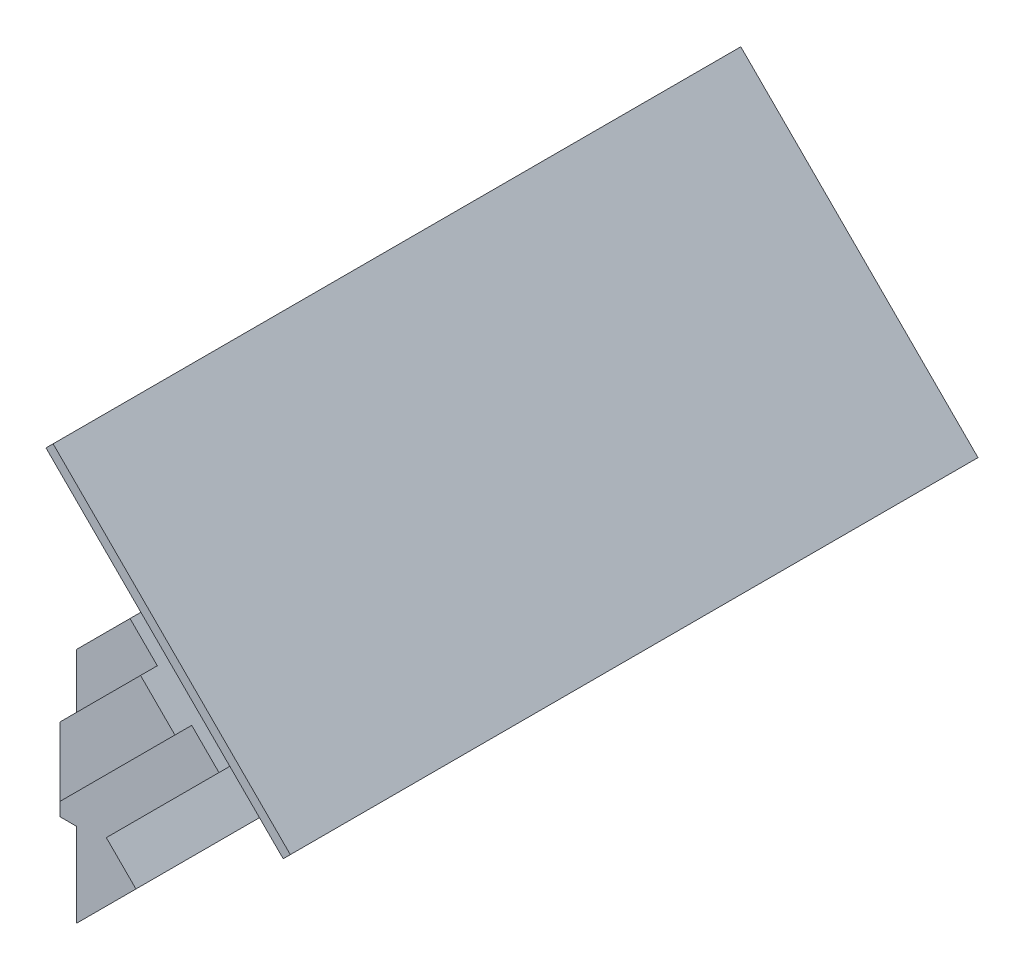
from build123d import *

# Parameters (mm, degrees)
MAIN_EXTRUSION_DEPTH                   = 15
ESQUISSE2_W                            = 10
ESQUISSE2_H                            = 9.5
WINDOW_EXTRUSION_DEPTH                 = 2.5
ESQUISSE5_R                            = 1.25
WINDOW_HOLE_EXTRUSION_DEPTH            = 25.728526038
FIXATION_TOP_MAKERBEAM_EXTRUSION_DEPTH = 10
ESQUISSE3_R                            = 1.5
WINDOW_HOLE_FIXATION_DEPTH             = 34.079263873
ESQUISSE4_R                            = 4.1
CENTRAL_FIXATION_DEPTH                 = 32.269584341
BOSS_EXTRU_2_DEPTH                     = 1
BOSS_EXTRU_6_DEPTH                     = 12
CONG_1_R                               = 4
ESQUISSE11_R                           = 1.6
ENL_V_MAT_EXTRU_2_DEPTH                = 35.185157598
ESQUISSE12_W                           = 41
ESQUISSE12_H                           = 20
BOSS_EXTRU_7_DEPTH                     = 0.6


with BuildPart() as part:
    # Esquisse1 → Main Extrusion (new, symmetric)
    with BuildSketch(Plane.XY):
        Polygon((0, 0), (0, 5), (-1, 5), (-1, 7.9), (0, 7.9), (0, 14.142135624), (3.181980515, 17.324116139), (10.253048327, 10.253048327), align=None)
    extrude(amount=MAIN_EXTRUSION_DEPTH, both=True)

    # Esquisse2 → Window Extrusion (cut)
    with BuildSketch(Plane(origin=(0, 0, 0), x_dir=(0, 0, -1), z_dir=(0.7071067811865512, -0.7071067811865438, 0))):
        with Locations((10, 9.75)):
            Rectangle(ESQUISSE2_W, ESQUISSE2_H)
    window_extrusion = extrude(amount=-WINDOW_EXTRUSION_DEPTH, mode=Mode.SUBTRACT)

    # Esquisse5 → Window Hole Extrusion (cut, through all)
    with BuildSketch(Plane(origin=(-1.767766953, 1.767766953, 0), x_dir=(0, 0, -1), z_dir=(0.7071067811865513, -0.7071067811865438, 0))):
        with Locations((10, 11.5)):
            Circle(ESQUISSE5_R)
    window_hole_extrusion = extrude(amount=-WINDOW_HOLE_EXTRUSION_DEPTH, mode=Mode.SUBTRACT)

    # Esquisse7 → Fixation Top MakerBeam Extrusion (add)
    with BuildSketch(Plane(origin=(10.253048327, 10.253048327, 0), x_dir=(0, 0, -1), z_dir=(0.7071067811865438, 0.7071067811865513, 0))):
        Polygon((-5.1, 2.5), (-5.1, 3.55), (-4.1, 3.55), (-4.1, 6.45), (-5.1, 6.45), (-5.1, 10), (-8.1, 10), (-8.1, 2.5), align=None)
    fixation_top_makerbeam_extrusion = extrude(amount=FIXATION_TOP_MAKERBEAM_EXTRUSION_DEPTH)

    # Window Symetry: Window Extrusion, Window Hole Extrusion, Fixation Top MakerBeam Extrusion across plane
    add(window_extrusion.mirror(Plane.XY), mode=Mode.SUBTRACT)
    add(window_hole_extrusion.mirror(Plane.XY), mode=Mode.SUBTRACT)
    add(fixation_top_makerbeam_extrusion.mirror(Plane.XY))

    # Esquisse3 → Window Hole Fixation (cut, through all)
    with BuildSketch(Plane.ZY.offset(1)):
        with Locations((0, 6.45)):
            Circle(ESQUISSE3_R)
    extrude(amount=-WINDOW_HOLE_FIXATION_DEPTH, mode=Mode.SUBTRACT)

    # Esquisse4 → Central Fixation (cut, through all)
    with BuildSketch(Plane.ZY.offset(-3)):
        with Locations((0, 6.45)):
            Circle(ESQUISSE4_R)
    extrude(amount=-CENTRAL_FIXATION_DEPTH, mode=Mode.SUBTRACT)

    # Esquisse6 → Boss.-Extru.2 (add)
    with BuildSketch(Plane.XY.offset(15)):
        Polygon((0, 10.88944443), (4.808326112, 15.697770542), (6.858935778, 13.647160877), (0, 6.788225099), align=None)
    extrude(amount=BOSS_EXTRU_2_DEPTH)

    # Esquisse8 → Boss.-Extru.6 (add)
    with BuildSketch(Plane(origin=(17.324116139, 17.324116139, 0), x_dir=(0, 0, -1), z_dir=(0.7071067811865434, 0.7071067811865517, 0))):
        Polygon((-8.1, 10), (-1.45, 10), (-1.45, 9), (1.45, 9), (1.45, 10), (8.1, 10), (8.1, 13), (-8.1, 13), align=None)
    extrude(amount=-BOSS_EXTRU_6_DEPTH)

    # Congé1
    cong_1_edges = [part.edges().sort_by_distance(p)[0] for p in [
        (0.707106781, 16.970562748, -8.1),
        (0.707106781, 16.970562748, 8.1),
    ]]
    fillet(cong_1_edges, radius=CONG_1_R)

    # Esquisse11 → Enlèv. mat.-Extru.2 (cut, through all)
    with BuildSketch(Plane(origin=(-9.192388155, 9.192388155, 0), x_dir=(0, 0, 1), z_dir=(-0.7071067811865517, 0.7071067811865434, 0))):
        with Locations((0, 19.5)):
            Circle(ESQUISSE11_R)
    extrude(amount=-ENL_V_MAT_EXTRU_2_DEPTH, mode=Mode.SUBTRACT)

    # Esquisse12 → Boss.-Extru.7 (add)
    with BuildSketch(Plane(origin=(25.378679656, 9.269552622, 0), x_dir=(0, 0, 1), z_dir=(-0.7071067811865438, -0.7071067811865513, 0))):
        with Locations((0.5, 19.390872965)):
            Rectangle(ESQUISSE12_W, ESQUISSE12_H)
    extrude(amount=BOSS_EXTRU_7_DEPTH)


solid = part.part
